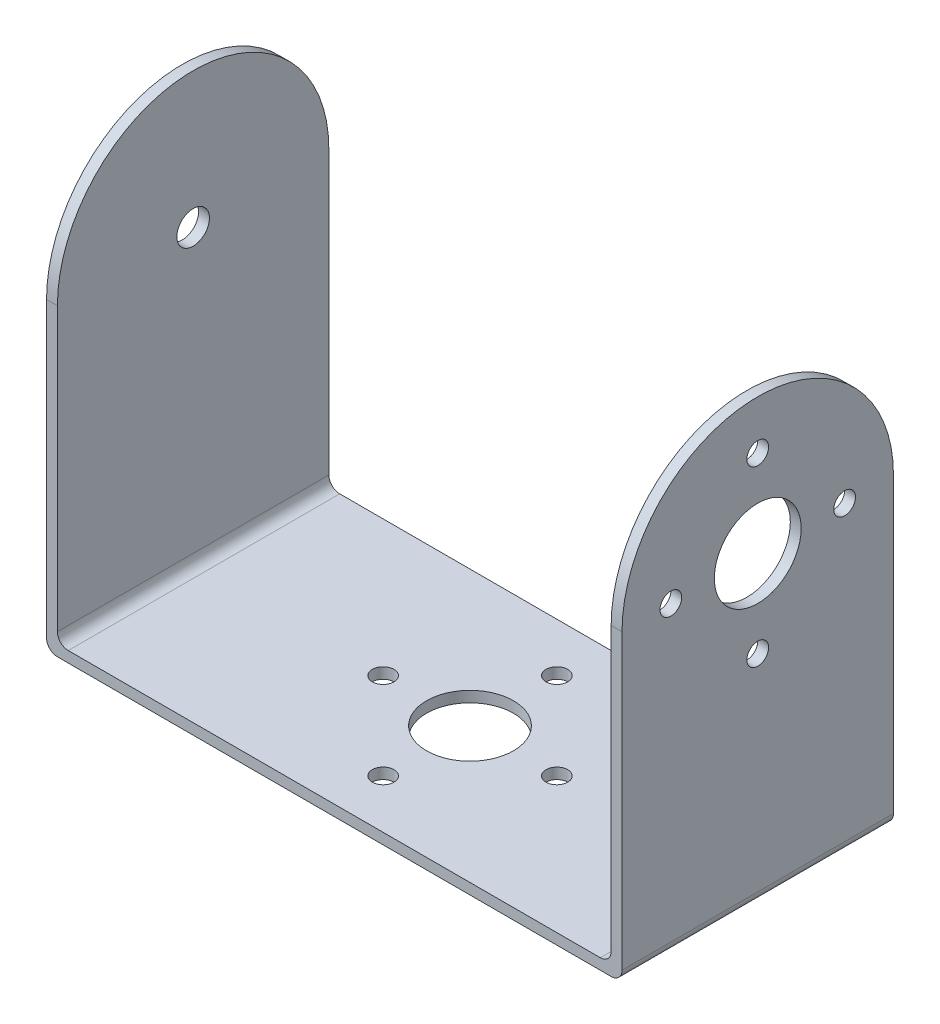
from build123d import *

# Parameters (mm, degrees)
BOSS_EXTRUDE1_DEPTH = 25
CUT_EXTRUDE1_DEPTH  = 71.9506871
SKETCH3_R           = 4
SKETCH3_R_2         = 1
CUT_EXTRUDE2_DEPTH  = 71.295803573
SKETCH4_R           = 4
SKETCH4_R_2         = 1
CUT_EXTRUDE3_DEPTH  = 25
SKETCH5_R           = 1.5
CUT_EXTRUDE4_DEPTH  = 25


with BuildPart() as part:
    # Sketch1 → Boss-Extrude1 (new body)
    with BuildSketch(Plane.XY):
        with BuildLine():
            Line((-0.5, 40), (0.5, 40))
            Line((0.5, 40), (0.5, 1.5))
            ThreePointArc((0.5, 1.5), (0.792893219, 0.792893219), (1.5, 0.5))
            Line((1.5, 0.5), (50.5, 0.5))
            ThreePointArc((50.5, 0.5), (51.207106781, 0.792893219), (51.5, 1.5))
            Line((51.5, 1.5), (51.5, 40))
            Line((51.5, 40), (52.5, 40))
            Line((52.5, 40), (52.5, 0.5))
            ThreePointArc((52.5, 0.5), (52.207106781, -0.207106781), (51.5, -0.5))
            Line((51.5, -0.5), (0.5, -0.5))
            ThreePointArc((0.5, -0.5), (-0.207106781, -0.207106781), (-0.5, 0.5))
            Line((-0.5, 0.5), (-0.5, 40))
        make_face()
    extrude(amount=-BOSS_EXTRUDE1_DEPTH)

    # Sketch2 → Cut-Extrude1 (cut, through all)
    with BuildSketch(Plane(origin=(52.5, 0, 0), x_dir=(0, 0, -1), z_dir=(1, 0, 0))):
        with BuildLine():
            Line((25, 40), (12.5, 40))
            ThreePointArc((12.5, 40), (21.338834765, 36.338834765), (25, 27.5))
            Line((25, 27.5), (25, 40))
        make_face()
        with BuildLine():
            Line((0, 40), (0, 27.5))
            ThreePointArc((0, 27.5), (3.661165235, 36.338834765), (12.5, 40))
            Line((12.5, 40), (0, 40))
        make_face()
    extrude(amount=-CUT_EXTRUDE1_DEPTH, mode=Mode.SUBTRACT)

    # Sketch3 → Cut-Extrude2 (cut, through all)
    with BuildSketch(Plane(origin=(0, 0.5, 0), x_dir=(1, 0, 0), z_dir=(0, 1, 0))):
        with Locations((26, 12.5)):
            Circle(SKETCH3_R)
        with Locations((34, 12.5)):
            Circle(SKETCH3_R_2)
        with Locations((26, 20.5)):
            Circle(SKETCH3_R_2)
        with Locations((26, 4.5)):
            Circle(SKETCH3_R_2)
        with Locations((18, 12.5)):
            Circle(SKETCH3_R_2)
    extrude(amount=-CUT_EXTRUDE2_DEPTH, mode=Mode.SUBTRACT)

    # Sketch4 → Cut-Extrude3 (cut)
    with BuildSketch(Plane(origin=(52.5, 0, 0), x_dir=(0, 0, -1), z_dir=(1, 0, 0))):
        with Locations((12.5, 27.5)):
            Circle(SKETCH4_R)
        with Locations((20.5, 27.5)):
            Circle(SKETCH4_R_2)
        with Locations((12.5, 35.5)):
            Circle(SKETCH4_R_2)
        with Locations((12.5, 19.5)):
            Circle(SKETCH4_R_2)
        with Locations((4.5, 27.5)):
            Circle(SKETCH4_R_2)
    extrude(amount=-CUT_EXTRUDE3_DEPTH, mode=Mode.SUBTRACT)

    # Sketch5 → Cut-Extrude4 (cut)
    with BuildSketch(Plane.ZY.offset(0.5)):
        with Locations((-12.5, 27.5)):
            Circle(SKETCH5_R)
    extrude(amount=-CUT_EXTRUDE4_DEPTH, mode=Mode.SUBTRACT)


solid = part.part
